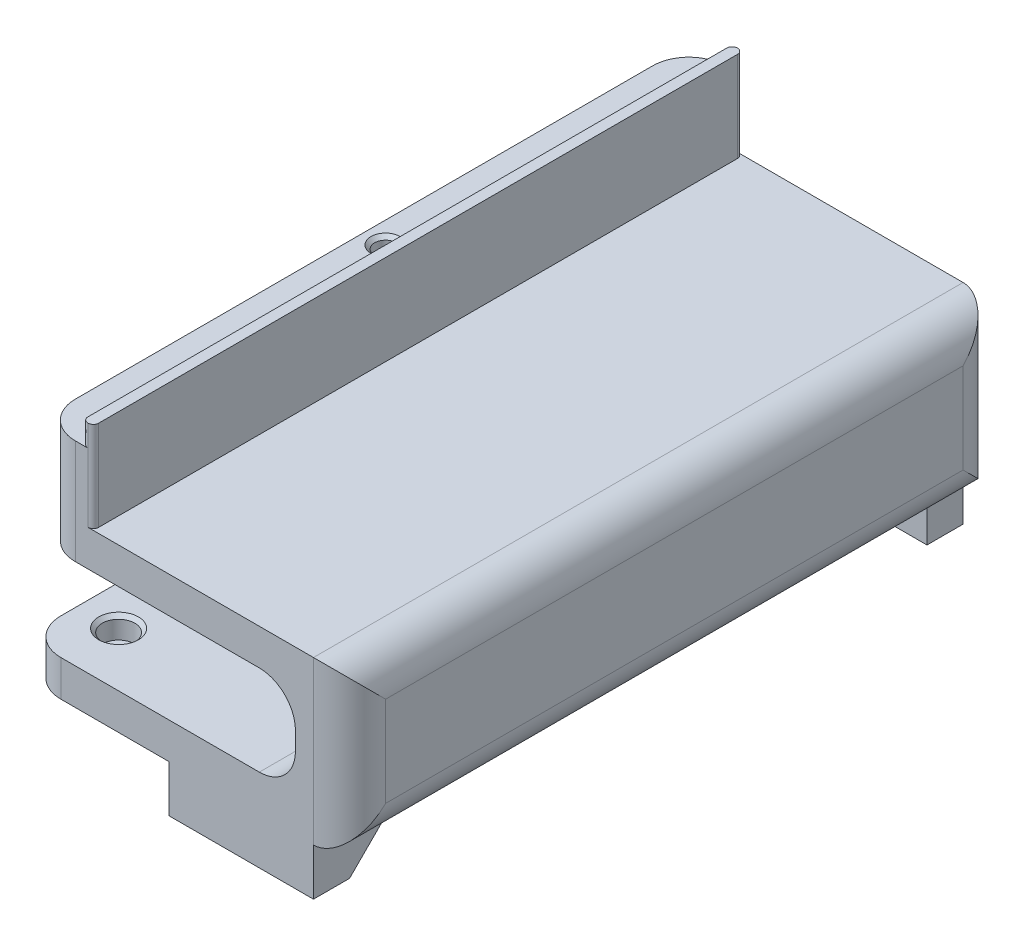
from build123d import *

# Parameters (mm, degrees)
BOSS_EXTRUDE1_DEPTH = 180
SKETCH2_R           = 2.6
CUT_EXTRUDE1_DEPTH  = 211
SKETCH2_3_R         = 4.5
CUT_EXTRUDE2_DEPTH  = 6
SKETCH3_R           = 3.05
CUT_EXTRUDE3_DEPTH  = 8
FILLET4_R           = 10
CHAMFER1_SIZE       = 1
FILLET5_R           = 1.5
SKETCH4_W           = 40
SKETCH4_H           = 10
BOSS_EXTRUDE2_DEPTH = 13
CHAMFER2_SIZE       = 13


# Some blends are built 0.0001 mm under size
with BuildPart() as part:
    # Sketch1 → Boss-Extrude1 (new body)
    with BuildSketch(Plane.XY):
        Polygon((0, 10), (0, 0), (90, 0), (90, 45), (19, 45), (19, 70), (16, 70), (16, 64), (4, 64), (4, 35), (75, 35), (75, 10), align=None)
    extrude(amount=BOSS_EXTRUDE1_DEPTH)

    # Sketch2 → Cut-Extrude1 (cut, through all)
    with BuildSketch(Plane(origin=(0, 10, 0), x_dir=(1, 0, 0), z_dir=(0, 1, 0))):
        with Locations(Location((11, -65, 0), (0, 0, 270))):
            Circle(SKETCH2_R)
        with Locations(Location((11, -15, 0), (0, 0, 270))):
            Circle(SKETCH2_R)
        with Locations(Location((11, -115, 0), (0, 0, 270))):
            Circle(SKETCH2_R)
        with Locations(Location((11, -165, 0), (0, 0, 270))):
            Circle(SKETCH2_R)
    extrude(amount=-CUT_EXTRUDE1_DEPTH, mode=Mode.SUBTRACT)

    # Sketch2<3> → Cut-Extrude2 (cut)
    with BuildSketch(Plane(origin=(0, 10, 0), x_dir=(1, 0, 0), z_dir=(0, 1, 0))):
        with Locations(Location((11, -65, 0), (0, 0, 270))):
            Circle(SKETCH2_3_R)
        with Locations(Location((11, -15, 0), (0, 0, 270))):
            Circle(SKETCH2_3_R)
        with Locations(Location((11, -115, 0), (0, 0, 270))):
            Circle(SKETCH2_3_R)
        with Locations(Location((11, -165, 0), (0, 0, 270))):
            Circle(SKETCH2_3_R)
    extrude(amount=-CUT_EXTRUDE2_DEPTH, mode=Mode.SUBTRACT)

    # Sketch3 → Cut-Extrude3 (cut)
    with BuildSketch(Plane(origin=(0, 64, 0), x_dir=(1, 0, 0), z_dir=(0, 1, 0))):
        with Locations(Location((10, -90, 0), (0, 0, 270))):
            Circle(SKETCH3_R)
    extrude(amount=-CUT_EXTRUDE3_DEPTH, mode=Mode.SUBTRACT)

    # Fillet4
    fillet4_edges = [part.edges().sort_by_distance(p)[0] for p in [
        (90, 22.5, 180),
        (0, 5, 0),
        (4, 49.5, 0),
        (90, 22.5, 0),
        (75, 10, 90),
        (75, 35, 90),
        (90, 45, 90),
        (90, 0, 90),
        (4, 49.5, 180),
        (0, 5, 180),
    ]]
    fillet(fillet4_edges, radius=FILLET4_R)

    # Chamfer1
    chamfer1_edges = [part.edges().sort_by_distance(p)[0] for p in [
        (10, 64, 86.95),
        (11, 10, 10.5),
        (11, 10, 60.5),
        (11, 10, 110.5),
        (11, 10, 160.5),
    ]]
    chamfer(chamfer1_edges, length=CHAMFER1_SIZE)

    # Fillet5
    fillet5_edges = [part.edges().sort_by_distance(p)[0] for p in [
        (19, 57.5, 0),
        (16, 67, 0),
        (19, 57.5, 180),
        (16, 67, 180),
    ]]
    fillet(fillet5_edges, radius=FILLET5_R - 0.0001)  # a hair under: the kernel refuses the full size

    # Sketch4 → Boss-Extrude2 (add)
    with BuildSketch(Plane.XZ):
        with Locations((60, 5)):
            Rectangle(SKETCH4_W, SKETCH4_H)
        with Locations((60, 175)):
            Rectangle(SKETCH4_W, SKETCH4_H)
    extrude(amount=BOSS_EXTRUDE2_DEPTH)

    # Chamfer2
    # the kernel refuses this chamfer: 13 mm, written as the material it adds along each edge
    with BuildSketch(Plane(origin=(40, 0, 170), x_dir=(0, 0.027495876610586372, -0.9996219169112968), z_dir=(1, 0, 0))) as chamfer2_piece_1_section:
        Polygon((CHAMFER2_SIZE * 0.999621916911, -CHAMFER2_SIZE * 0.0274958766106), (-CHAMFER2_SIZE * 0.0274958766106, -CHAMFER2_SIZE * 0.999621916911), (0, 0), align=None)
    chamfer2_piece_1 = extrude(amount=40, mode=Mode.PRIVATE)
    chamfer2_piece_1 = split(chamfer2_piece_1, bisect_by=Plane(origin=(60, -13, 165.704745994), z_dir=(0, 1, 0)), keep=Keep.TOP, mode=Mode.PRIVATE)
    add(chamfer2_piece_1)


solid = part.part
